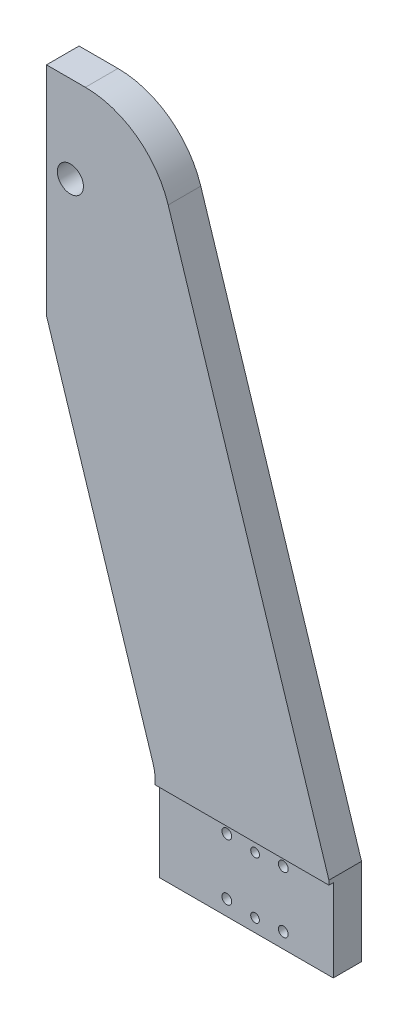
from build123d import *

# Parameters (mm, degrees)
SALIENTE_EXTRUIR1_DEPTH                              = 15
CROQUIS2_R                                           = 6
CORTAR_EXTRUIR1_DEPTH                                = 311.845620847
PERFORADOR_PARA_ROSCAR_PARA_MACHO_DE_ROS_D           = 3.3
PERFORADOR_PARA_ROSCAR_PARA_MACHO_DE_ROS_DEPTH       = 7
PERFORADOR_PARA_ROSCAR_PARA_MACHO_DE_ROS_TIP         = 0.991420021
CROQUIS9_W                                           = 80
CROQUIS9_H                                           = 38
CORTAR_EXTRUIR2_DEPTH                                = 2
TALADROS_DE_ESPIGA_DE_4_0MM1_D                       = 4
TALADROS_DE_ESPIGA_DE_4_0MM1_DEPTH                   = 17
TALADROS_DE_ESPIGA_DE_4_0MM1_TIP                     = 1.201721238
TALADRO_ROSCADO_M41_D                                = 3.3
TALADRO_ROSCADO_M41_DEPTH                            = 11.5
TALADRO_ROSCADO_M41_TIP                              = 0.991420021
REFRENTADO_PARA_TORNILLO_CON_CABEZA_HUEC_D           = 4.5
REFRENTADO_PARA_TORNILLO_CON_CABEZA_HUEC_CBORE_D     = 8
REFRENTADO_PARA_TORNILLO_CON_CABEZA_HUEC_CBORE_DEPTH = 4.4
TALADROS_DE_ESPIGA_DE_4_0MM2_D                       = 4


with BuildPart() as part:
    # Croquis1 → Saliente-Extruir1 (new body)
    with BuildSketch(Plane.XY):
        with BuildLine():
            Line((80, 0), (80, 40))
            Line((80, 40), (6.016406662, 272.145884266))
            ThreePointArc((6.016406662, 272.145884266), (-8.492384821, 292.294236101), (-32.094976092, 300))
            Line((-32.094976092, 300), (-50, 300))
            Line((-50, 300), (-50, 200))
            Line((-50, 200), (-0.944308623, 46.072942133))
            ThreePointArc((-0.944308623, 46.072942133), (-0.23748716, 43.0729605), (0, 40))
            Line((0, 40), (0, 0))
            Line((0, 0), (80, 0))
        make_face()
    extrude(amount=SALIENTE_EXTRUIR1_DEPTH)

    # Croquis2 → Cortar-Extruir1 (cut, through all)
    with BuildSketch(Plane(origin=(0, 0, 0), x_dir=(-1, 0, 0), z_dir=(0, 0, -1))):
        with Locations((39, 260)):
            Circle(CROQUIS2_R)
    extrude(amount=-CORTAR_EXTRUIR1_DEPTH, mode=Mode.SUBTRACT)

    # Perforador para roscar para macho de roscar para M44
    with Locations(Plane(origin=(0, 0, 0), x_dir=(-1, 0, 0), z_dir=(0, 0, -1))):
        with Locations((39, 241.75), (39, 278.25)):
            Hole(PERFORADOR_PARA_ROSCAR_PARA_MACHO_DE_ROS_D / 2, depth=PERFORADOR_PARA_ROSCAR_PARA_MACHO_DE_ROS_DEPTH)
            with Locations((0, 0, -(PERFORADOR_PARA_ROSCAR_PARA_MACHO_DE_ROS_DEPTH + PERFORADOR_PARA_ROSCAR_PARA_MACHO_DE_ROS_TIP / 2))):  # 118° drill point
                Cone(0, PERFORADOR_PARA_ROSCAR_PARA_MACHO_DE_ROS_D / 2, PERFORADOR_PARA_ROSCAR_PARA_MACHO_DE_ROS_TIP, mode=Mode.SUBTRACT)

    # Croquis9 → Cortar-Extruir2 (cut)
    with BuildSketch(Plane.XY.offset(15)):
        with Locations((40, 19)):
            Rectangle(CROQUIS9_W, CROQUIS9_H)
    extrude(amount=-CORTAR_EXTRUIR2_DEPTH, mode=Mode.SUBTRACT)

    # Taladros de espiga de Ø4.0mm1
    with Locations(Plane.ZY.offset(50)):
        with Locations((6, 274), (6, 246)):
            Hole(TALADROS_DE_ESPIGA_DE_4_0MM1_D / 2, depth=TALADROS_DE_ESPIGA_DE_4_0MM1_DEPTH)
            with Locations((0, 0, -(TALADROS_DE_ESPIGA_DE_4_0MM1_DEPTH + TALADROS_DE_ESPIGA_DE_4_0MM1_TIP / 2))):  # 118° drill point
                Cone(0, TALADROS_DE_ESPIGA_DE_4_0MM1_D / 2, TALADROS_DE_ESPIGA_DE_4_0MM1_TIP, mode=Mode.SUBTRACT)

    # Taladro roscado M41
    with Locations(Plane.ZY.offset(50)):
        with Locations((6, 285), (6, 235)):
            Hole(TALADRO_ROSCADO_M41_D / 2, depth=TALADRO_ROSCADO_M41_DEPTH)
            with Locations((0, 0, -(TALADRO_ROSCADO_M41_DEPTH + TALADRO_ROSCADO_M41_TIP / 2))):  # 118° drill point
                Cone(0, TALADRO_ROSCADO_M41_D / 2, TALADRO_ROSCADO_M41_TIP, mode=Mode.SUBTRACT)

    # Refrentado para tornillo con cabeza hueca de M41 (through all)
    with Locations(Plane(origin=(0, 0, 0), x_dir=(-1, 0, 0), z_dir=(0, 0, -1))):
        with Locations((-57, 7), (-57, 33), (-31, 33), (-31, 7)):
            CounterBoreHole(REFRENTADO_PARA_TORNILLO_CON_CABEZA_HUEC_D / 2, REFRENTADO_PARA_TORNILLO_CON_CABEZA_HUEC_CBORE_D / 2, REFRENTADO_PARA_TORNILLO_CON_CABEZA_HUEC_CBORE_DEPTH)

    # Taladros de espiga de Ø4.0mm2 (through all)
    with Locations(Plane(origin=(0, 0, 0), x_dir=(-1, 0, 0), z_dir=(0, 0, -1))):
        with Locations((-44, 32), (-44, 6)):
            Hole(TALADROS_DE_ESPIGA_DE_4_0MM2_D / 2)


solid = part.part
